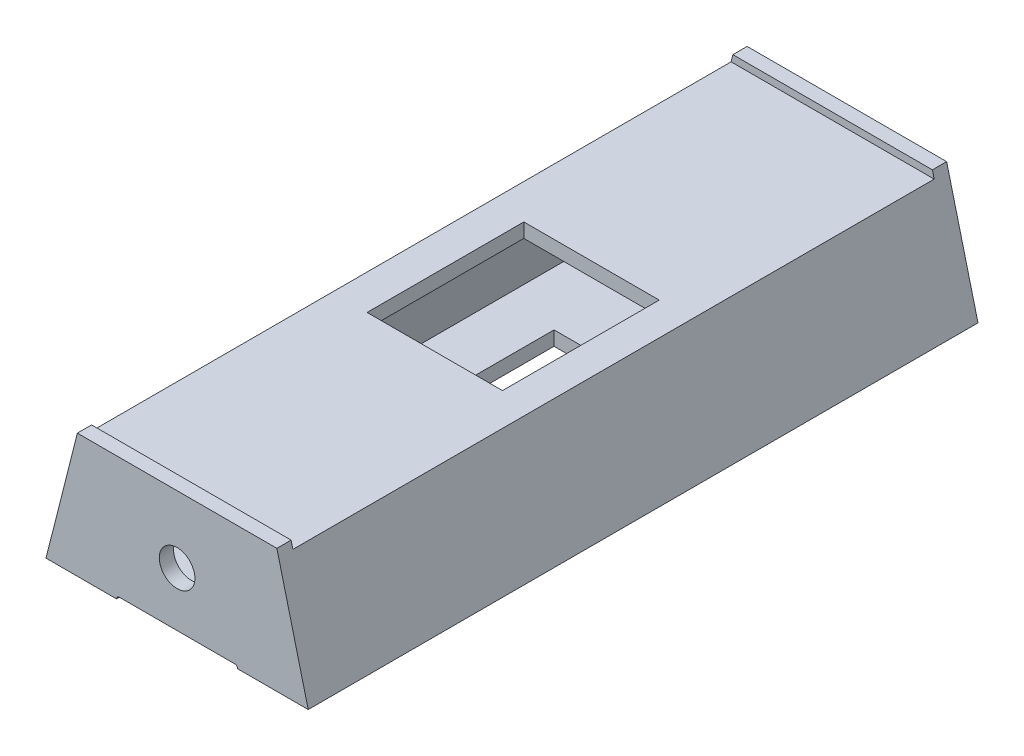
from build123d import *

# Parameters (mm, degrees)
DODANIE_WYCI_GNI_CIE1_DEPTH = 10
WYTNIJ_WYCI_GNI_CIE1_REACH  = 105.793
SZKIC2_R                    = 14
DODANIE_WYCI_GNI_CIE2_DEPTH = 450
DODANIE_WYCI_GNI_CIE3_DEPTH = 10
WYTNIJ_WYCI_GNI_CIE2_REACH  = 483.22
SZKIC5_R                    = 12.5
SZKIC7_W                    = 85
SZKIC7_H                    = 470
WYTNIJ_WYCI_GNI_CIE3_DEPTH  = 2
ZAOKR_GLENIE1_R             = 2
WYTNIJ_WYCI_GNI_CIE4_REACH  = 488.404
SZKIC8_W                    = 81
SZKIC8_H                    = 140
WYTNIJ_WYCI_GNI_CIE5_REACH  = 487.889
SZKIC9_W                    = 95
SZKIC9_H                    = 110


with BuildPart() as part:
    # Szkic1 → Dodanie-wyciągnięcie1 (new body)
    with BuildSketch(Plane.XY):
        Polygon((70, 47), (-70, 47), (-92, -40), (92, -40), align=None)
    extrude(amount=DODANIE_WYCI_GNI_CIE1_DEPTH)

    # Szkic2 → Wytnij-wyciągnięcie1 (cut, up to next)
    with BuildSketch(Plane(origin=(0, 0, 0), x_dir=(-1, 0, 0), z_dir=(0, 0, -1)), mode=Mode.PRIVATE) as wytnij_wyci_gni_cie1_sk1:
        Circle(SZKIC2_R)
    wytnij_wyci_gni_cie1_tool1 = extrude(wytnij_wyci_gni_cie1_sk1.sketch, amount=-WYTNIJ_WYCI_GNI_CIE1_REACH, mode=Mode.PRIVATE) & part.part
    add(wytnij_wyci_gni_cie1_tool1.solids().sort_by_distance((0, 0, 0))[0], mode=Mode.SUBTRACT)

    # Szkic3 → Dodanie-wyciągnięcie2 (add)
    with BuildSketch(Plane.XY.offset(10)):
        Polygon((-71.264367816, 42), (71.264367816, 42), (92, -40), (-92, -40), align=None)
        Polygon((-63.478332297, 32), (63.478332297, 32), (78.65074609, -28), (-78.65074609, -28), align=None, mode=Mode.SUBTRACT)
    extrude(amount=DODANIE_WYCI_GNI_CIE2_DEPTH)

    # Szkic4 → Dodanie-wyciągnięcie3 (add)
    with BuildSketch(Plane.XY.offset(460)):
        Polygon((-70, 47), (-92, -40), (92, -40), (70, 47), align=None)
    extrude(amount=DODANIE_WYCI_GNI_CIE3_DEPTH)

    # Szkic5 → Wytnij-wyciągnięcie2 (cut, up to next)
    with BuildSketch(Plane.XY.offset(470), mode=Mode.PRIVATE) as wytnij_wyci_gni_cie2_sk1:
        Circle(SZKIC5_R)
    wytnij_wyci_gni_cie2_tool1 = extrude(wytnij_wyci_gni_cie2_sk1.sketch, amount=-WYTNIJ_WYCI_GNI_CIE2_REACH, mode=Mode.PRIVATE) & part.part
    add(wytnij_wyci_gni_cie2_tool1.solids().sort_by_distance((0, 0, 470))[0], mode=Mode.SUBTRACT)

    # Szkic7 → Wytnij-wyciągnięcie3 (cut)
    with BuildSketch(Plane.XZ.offset(40)):
        with Locations((0, 235)):
            Rectangle(SZKIC7_W, SZKIC7_H)
    extrude(amount=-WYTNIJ_WYCI_GNI_CIE3_DEPTH, mode=Mode.SUBTRACT)

    # Zaokrąglenie1
    zaokr_glenie1_edges = [part.edges().sort_by_distance(p)[0] for p in [
        (42.5, -38, 235),
        (-42.5, -38, 235),
    ]]
    fillet(zaokr_glenie1_edges, radius=ZAOKR_GLENIE1_R - 0.0001)  # a hair under: the kernel refuses the full size

    # Szkic8 → Wytnij-wyciągnięcie4 (cut, up to next)
    with BuildSketch(Plane.XZ.offset(38), mode=Mode.PRIVATE) as wytnij_wyci_gni_cie4_sk1:
        with Locations((0, 235)):
            Rectangle(SZKIC8_W, SZKIC8_H)
    wytnij_wyci_gni_cie4_tool1 = extrude(wytnij_wyci_gni_cie4_sk1.sketch, amount=-WYTNIJ_WYCI_GNI_CIE4_REACH, mode=Mode.PRIVATE) & part.part
    add(wytnij_wyci_gni_cie4_tool1.solids().sort_by_distance((0, -38, 235))[0], mode=Mode.SUBTRACT)

    # Szkic9 → Wytnij-wyciągnięcie5 (cut, up to next)
    with BuildSketch(Plane(origin=(0, 42, 0), x_dir=(1, 0, 0), z_dir=(0, 1, 0)), mode=Mode.PRIVATE) as wytnij_wyci_gni_cie5_sk1:
        with Locations((0.805940964, -235)):
            Rectangle(SZKIC9_W, SZKIC9_H)
    wytnij_wyci_gni_cie5_tool1 = extrude(wytnij_wyci_gni_cie5_sk1.sketch, amount=-WYTNIJ_WYCI_GNI_CIE5_REACH, mode=Mode.PRIVATE) & part.part
    add(wytnij_wyci_gni_cie5_tool1.solids().sort_by_distance((0.805941, 42, 235))[0], mode=Mode.SUBTRACT)


solid = part.part
